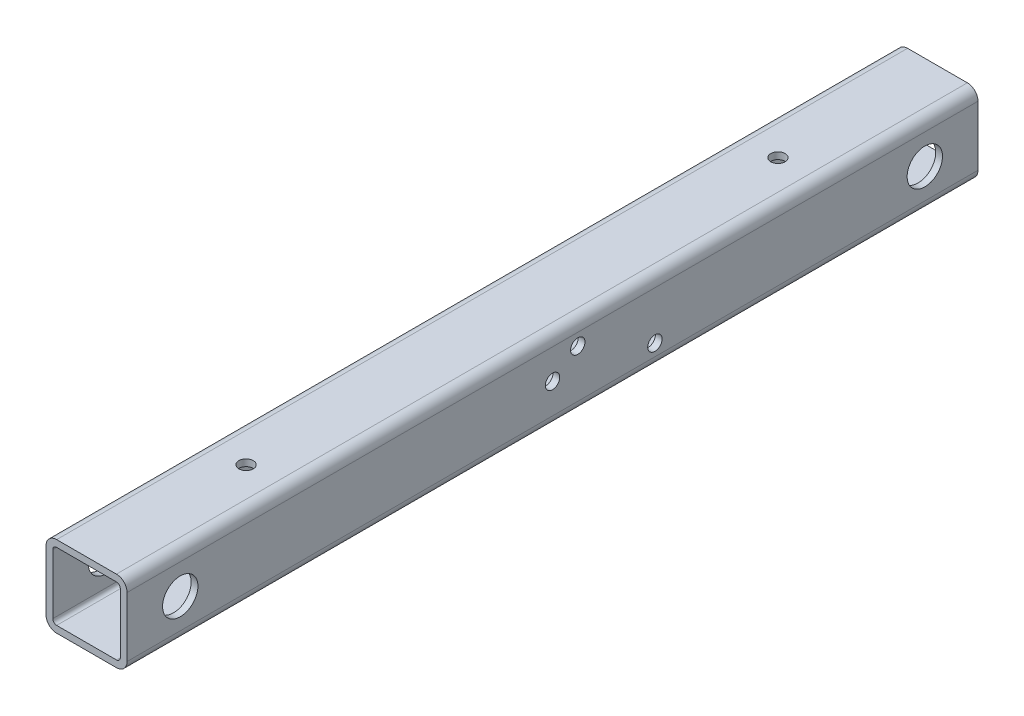
from build123d import *

# Parameters (mm, degrees)
BOSS_EXTRUDE1_DEPTH     = 400
CUT_EXTRUDE1_DEPTH      = 401.906229685
CUT_EXTRUDE1_DEPTH_BACK = 401.906229685
SKETCH2_R               = 8.3125
CUT_EXTRUDE2_DEPTH      = 401.906229685
CUT_EXTRUDE2_DEPTH_BACK = 401.906229685
SKETCH3_R               = 3.38
CUT_EXTRUDE3_DEPTH      = 401.906229685
CUT_EXTRUDE3_DEPTH_BACK = 401.906229685
SKETCH4_R               = 3.38
CUT_EXTRUDE4_DEPTH      = 401.906229685
CUT_EXTRUDE4_DEPTH_BACK = 401.906229685
SKETCH5_R               = 3.38


with BuildPart() as part:
    # Sketch1 → Boss-Extrude1 (new body)
    with BuildSketch(Plane.XY):
        with BuildLine():
            Line((-14.05, 19.05), (14.05, 19.05))
            ThreePointArc((14.05, 19.05), (17.585533906, 17.585533906), (19.05, 14.05))
            Line((19.05, 14.05), (19.05, -14.05))
            ThreePointArc((19.05, -14.05), (17.585533906, -17.585533906), (14.05, -19.05))
            Line((14.05, -19.05), (-14.05, -19.05))
            ThreePointArc((-14.05, -19.05), (-17.585533906, -17.585533906), (-19.05, -14.05))
            Line((-19.05, -14.05), (-19.05, 14.05))
            ThreePointArc((-19.05, 14.05), (-17.585533906, 17.585533906), (-14.05, 19.05))
        make_face()
        with BuildLine():
            Line((-15.875, 14.05), (-15.875, -14.05))
            ThreePointArc((-15.875, -14.05), (-15.340469876, -15.340469876), (-14.05, -15.875))
            Line((-14.05, -15.875), (14.05, -15.875))
            ThreePointArc((14.05, -15.875), (15.340469876, -15.340469876), (15.875, -14.05))
            Line((15.875, -14.05), (15.875, 14.05))
            ThreePointArc((15.875, 14.05), (15.340469876, 15.340469876), (14.05, 15.875))
            Line((14.05, 15.875), (-14.05, 15.875))
            ThreePointArc((-14.05, 15.875), (-15.340469876, 15.340469876), (-15.875, 14.05))
        make_face(mode=Mode.SUBTRACT)
    extrude(amount=BOSS_EXTRUDE1_DEPTH)

    # Sketch2 → Cut-Extrude1 (cut, two sides: drawn at the far end of the back side and taken through both)
    with BuildSketch(Plane(origin=(0, 0, 0), x_dir=(0, 0, -1), z_dir=(1, 0, 0)).offset(-CUT_EXTRUDE1_DEPTH_BACK)):
        with Locations((-375, 0)):
            Circle(SKETCH2_R)
        with Locations((-25, 0)):
            Circle(SKETCH2_R)
    extrude(amount=CUT_EXTRUDE1_DEPTH + CUT_EXTRUDE1_DEPTH_BACK, mode=Mode.SUBTRACT)

    # Sketch3 → Cut-Extrude2 (cut, two sides: drawn at the far end of the back side and taken through both)
    with BuildSketch(Plane(origin=(0, 0, 0), x_dir=(1, 0, 0), z_dir=(0, 1, 0)).offset(-CUT_EXTRUDE2_DEPTH_BACK)):
        with Locations((0, -325)):
            Circle(SKETCH3_R)
        with Locations((0, -75)):
            Circle(SKETCH3_R)
    extrude(amount=CUT_EXTRUDE2_DEPTH + CUT_EXTRUDE2_DEPTH_BACK, mode=Mode.SUBTRACT)

    # Sketch4 → Cut-Extrude3 (cut, two sides: drawn at the far end of the back side and taken through both)
    with BuildSketch(Plane(origin=(0, 0, 0), x_dir=(0, 0, -1), z_dir=(1, 0, 0)).offset(-CUT_EXTRUDE3_DEPTH_BACK)):
        with Locations((-200, 0)):
            Circle(SKETCH4_R)
    extrude(amount=CUT_EXTRUDE3_DEPTH + CUT_EXTRUDE3_DEPTH_BACK, mode=Mode.SUBTRACT)

    # Sketch5 → Cut-Extrude4 (cut, two sides: drawn at the far end of the back side and taken through both)
    with BuildSketch(Plane(origin=(0, 0, 0), x_dir=(0, 0, -1), z_dir=(1, 0, 0)).offset(-CUT_EXTRUDE4_DEPTH_BACK)):
        with Locations((-188.126155741, 8.452365235)):
            Circle(SKETCH5_R)
        with Locations((-151.873844259, -8.452365235)):
            Circle(SKETCH5_R)
    extrude(amount=CUT_EXTRUDE4_DEPTH + CUT_EXTRUDE4_DEPTH_BACK, mode=Mode.SUBTRACT)


solid = part.part
